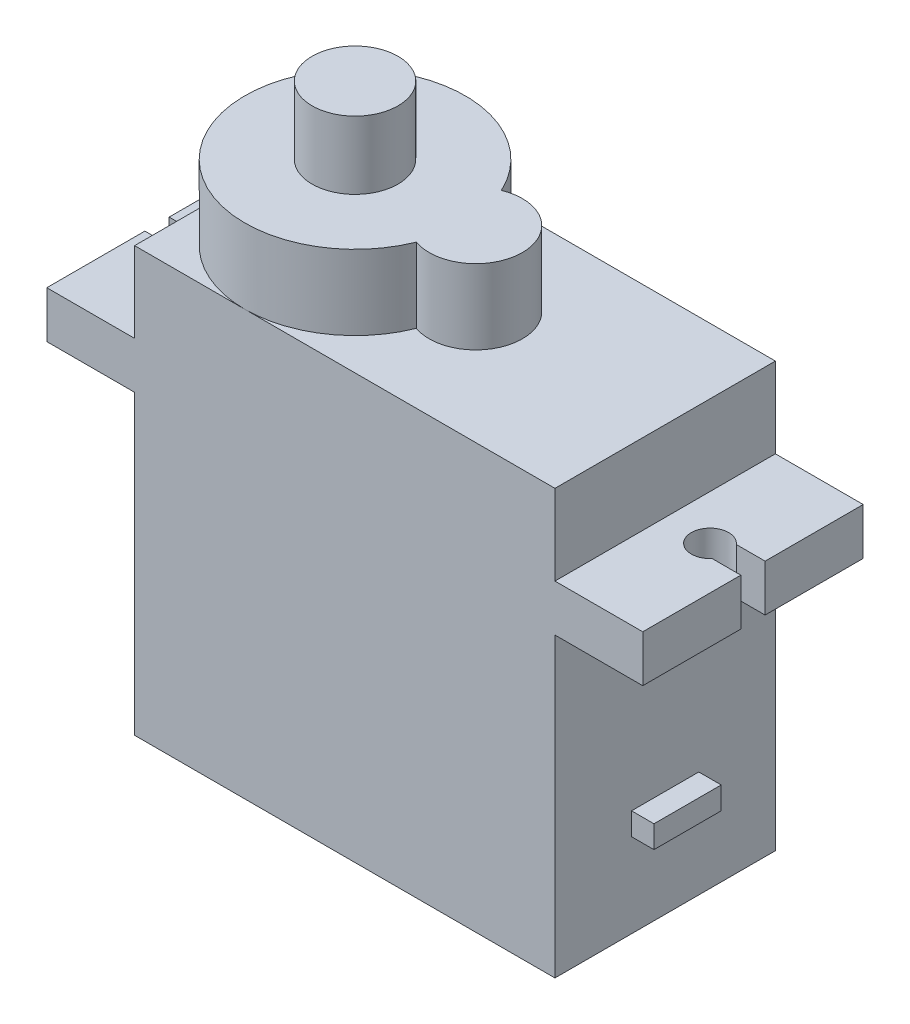
from build123d import *

# Parameters (mm, degrees)
BOSS_EXTRU_1_DEPTH      = 11.8
ESQUISSE2_R             = 5.9
BOSS_EXTRU_3_DEPTH      = 4
ESQUISSE3_R             = 2.5
BOSS_EXTRU_4_DEPTH      = 4
ESQUISSE5_R             = 2.3
BOSS_EXTRU_5_DEPTH      = 3.63
ENL_V_MAT_EXTRU_7_REACH = 36.895
ESQUISSE7_W             = 3.6
ESQUISSE7_H             = 1.2
BOSS_EXTRU_7_DEPTH      = 1.2


with BuildPart() as part:
    # Esquisse1 → Boss.-Extru.1 (new body)
    with BuildSketch(Plane.XY):
        Polygon((0, 0), (-22.5, 0), (-22.5, 15.9), (-27.2, 15.9), (-27.2, 18.4), (-22.5, 18.4), (-22.5, 22.7), (0, 22.7), (0, 18.4), (4.7, 18.4), (4.7, 15.9), (0, 15.9), align=None)
    extrude(amount=BOSS_EXTRU_1_DEPTH)

    # Esquisse2 → Boss.-Extru.3 (add)
    with BuildSketch(Plane(origin=(0, 22.7, 0), x_dir=(1, 0, 0), z_dir=(0, 1, 0))):
        with Locations((-16.6, -5.9)):
            Circle(ESQUISSE2_R)
    extrude(amount=BOSS_EXTRU_3_DEPTH)

    # Esquisse3 → Boss.-Extru.4 (add)
    with BuildSketch(Plane(origin=(0, 22.7, 0), x_dir=(1, 0, 0), z_dir=(0, 1, 0))):
        with Locations((-10.3, -5.738368037)):
            Circle(ESQUISSE3_R)
    extrude(amount=BOSS_EXTRU_4_DEPTH)

    # Esquisse5 → Boss.-Extru.5 (add)
    with BuildSketch(Plane(origin=(0, 26.7, 0), x_dir=(1, 0, 0), z_dir=(0, 1, 0))):
        with Locations((-16.6, -5.9)):
            Circle(ESQUISSE5_R)
    extrude(amount=BOSS_EXTRU_5_DEPTH)

    # Esquisse6 → Enlèv. mat.-Extru.7 (cut, up to next)
    with BuildSketch(Plane(origin=(0, 18.4, 0), x_dir=(1, 0, 0), z_dir=(0, 1, 0)), mode=Mode.PRIVATE) as enl_v_mat_extru_7_sk1:
        with BuildLine():
            Line((6.661887407, -5.9), (6.661887407, -5.25))
            Line((6.661887407, -5.25), (3.159934208, -5.25))
            ThreePointArc((3.159934208, -5.25), (1.4, -5.9), (3.159934208, -6.55))
            Line((3.159934208, -6.55), (6.661887407, -6.55))
            Line((6.661887407, -6.55), (6.661887407, -5.9))
        make_face()
    enl_v_mat_extru_7_tool1 = extrude(enl_v_mat_extru_7_sk1.sketch, amount=-ENL_V_MAT_EXTRU_7_REACH, mode=Mode.PRIVATE) & part.part
    # Esquisse6 → Enlèv. mat.-Extru.7 (cut, up to next)
    with BuildSketch(Plane(origin=(0, 18.4, 0), x_dir=(1, 0, 0), z_dir=(0, 1, 0)), mode=Mode.PRIVATE) as enl_v_mat_extru_7_sk2:
        with BuildLine():
            Line((-29.161887407, -5.25), (-25.659934208, -5.25))
            ThreePointArc((-25.659934208, -5.25), (-23.9, -5.9), (-25.659934208, -6.55))
            Line((-25.659934208, -6.55), (-29.161887407, -6.55))
            Line((-29.161887407, -6.55), (-29.161887407, -5.9))
            Line((-29.161887407, -5.9), (-29.161887407, -5.25))
        make_face()
    enl_v_mat_extru_7_tool2 = extrude(enl_v_mat_extru_7_sk2.sketch, amount=-ENL_V_MAT_EXTRU_7_REACH, mode=Mode.PRIVATE) & part.part
    add(enl_v_mat_extru_7_tool1.solids().sort_by_distance((3.903633, 18.4, 5.9))[0], mode=Mode.SUBTRACT)
    add(enl_v_mat_extru_7_tool2.solids().sort_by_distance((-26.403633, 18.4, 5.9))[0], mode=Mode.SUBTRACT)

    # Esquisse7 → Boss.-Extru.7 (add)
    with BuildSketch(Plane(origin=(0, 0, 0), x_dir=(0, 0, -1), z_dir=(1, 0, 0))):
        with Locations((-5.9, 5.1)):
            Rectangle(ESQUISSE7_W, ESQUISSE7_H)
    extrude(amount=BOSS_EXTRU_7_DEPTH)


solid = part.part
